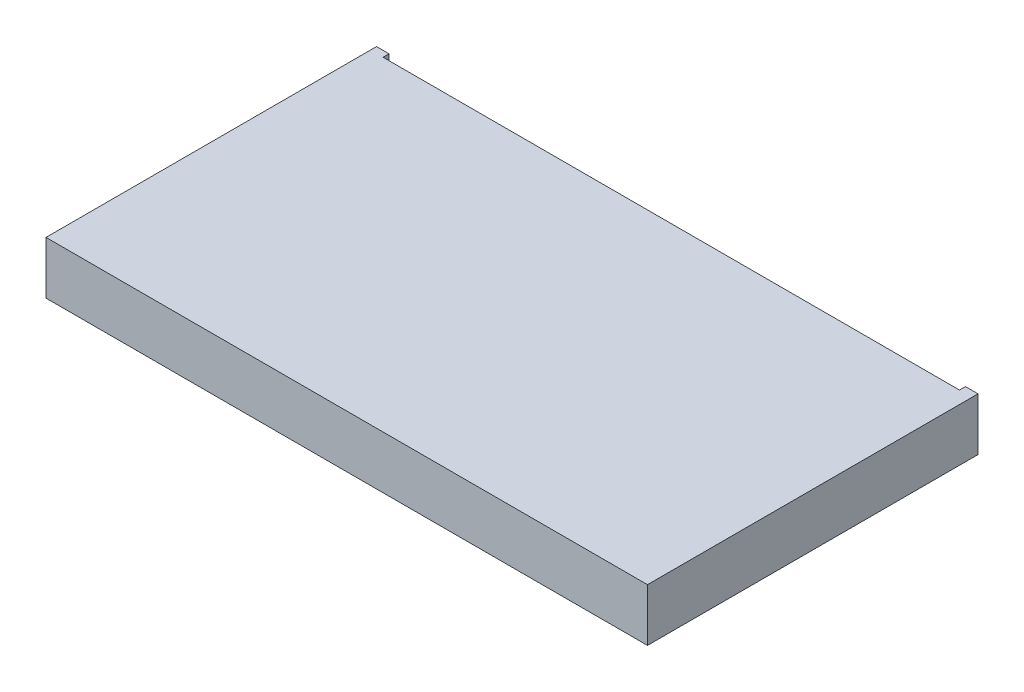
from build123d import *

# Parameters (mm, degrees)
SKETCH1_W           = 240
SKETCH1_H           = 351.15
BOSS_EXTRUDE3_DEPTH = 21
SKETCH5_W           = 248.975913499
SKETCH5_H           = 113.170869772
CUT_EXTRUDE5_DEPTH  = 254
CAVITY1_START       = -93.176553254
CAVITY1_DEPTH       = 230
SKETCH6_W           = 230
SKETCH6_H           = 2.384694545
CUT_EXTRUDE6_DEPTH  = 10


with BuildPart() as part:
    # Sketch1 → Boss-Extrude3 (new body)
    with BuildSketch(Plane(origin=(0, 0, 0), x_dir=(1, 0, 0), z_dir=(0, 1, 0))):
        with Locations((21.823446746, 98.176553254)):
            Rectangle(SKETCH1_W, SKETCH1_H)
    extrude(amount=BOSS_EXTRUDE3_DEPTH)

    # Sketch5 → Cut-Extrude5 (cut)
    with BuildSketch(Plane(origin=(0, 0, -54.481553254), x_dir=(-1, 0, 0), z_dir=(0, 0, -1))):
        with Locations((-20.8478358, 4.110963623)):
            Rectangle(SKETCH5_W, SKETCH5_H)
    extrude(amount=CUT_EXTRUDE5_DEPTH, mode=Mode.SUBTRACT)

    # Cavity1: read off the stored shape, not the designer's step
    # Cavity1 outline → Cavity1 (cut)
    with BuildSketch(Plane.YZ.offset(CAVITY1_START)):
        Polygon((18.5, 60.403141291), (13.5, 67.518446746), (13.5, 67.903141291), (18.5, 67.903141291), (13.5, 75.018446746), (5, 75.018446746), (5, -54.481553254), (13.5, -54.481553254), (13.5, -52.096858709), (18.5, -52.096858709), (13.5, -44.981553254), (13.5, -44.596858709), (18.5, -44.596858709), (13.5, -37.481553254), (13.5, -37.096858709), (18.5, -37.096858709), (13.5, -29.981553254), (13.5, -29.596858709), (18.5, -29.596858709), (13.5, -22.481553254), (13.5, -22.096858709), (18.5, -22.096858709), (13.5, -14.981553254), (13.5, -14.596858709), (18.5, -14.596858709), (13.5, -7.481553254), (13.5, -7.096858709), (18.5, -7.096858709), (13.5, 0.018446746), (13.5, 0.403141291), (18.5, 0.403141291), (13.5, 7.518446746), (13.5, 7.903141291), (18.5, 7.903141291), (13.5, 15.018446746), (13.5, 15.403141291), (18.5, 15.403141291), (13.5, 22.518446746), (13.5, 22.903141291), (18.5, 22.903141291), (13.5, 30.018446746), (13.5, 30.403141291), (18.5, 30.403141291), (13.5, 37.518446746), (13.5, 37.903141291), (18.5, 37.903141291), (13.5, 45.018446746), (13.5, 45.403141291), (18.5, 45.403141291), (13.5, 52.518446746), (13.5, 52.903141291), (18.5, 52.903141291), (13.5, 60.018446746), (13.5, 60.403141291), align=None)
    extrude(amount=CAVITY1_DEPTH, mode=Mode.SUBTRACT)

    # Sketch6 → Cut-Extrude6 (cut)
    with BuildSketch(Plane(origin=(0, 13.5, 0), x_dir=(-1, 0, 0), z_dir=(0, -1, 0))):
        with Locations((-21.823446746, 53.289205982)):
            Rectangle(SKETCH6_W, SKETCH6_H)
    extrude(amount=-CUT_EXTRUDE6_DEPTH, mode=Mode.SUBTRACT)


solid = part.part
